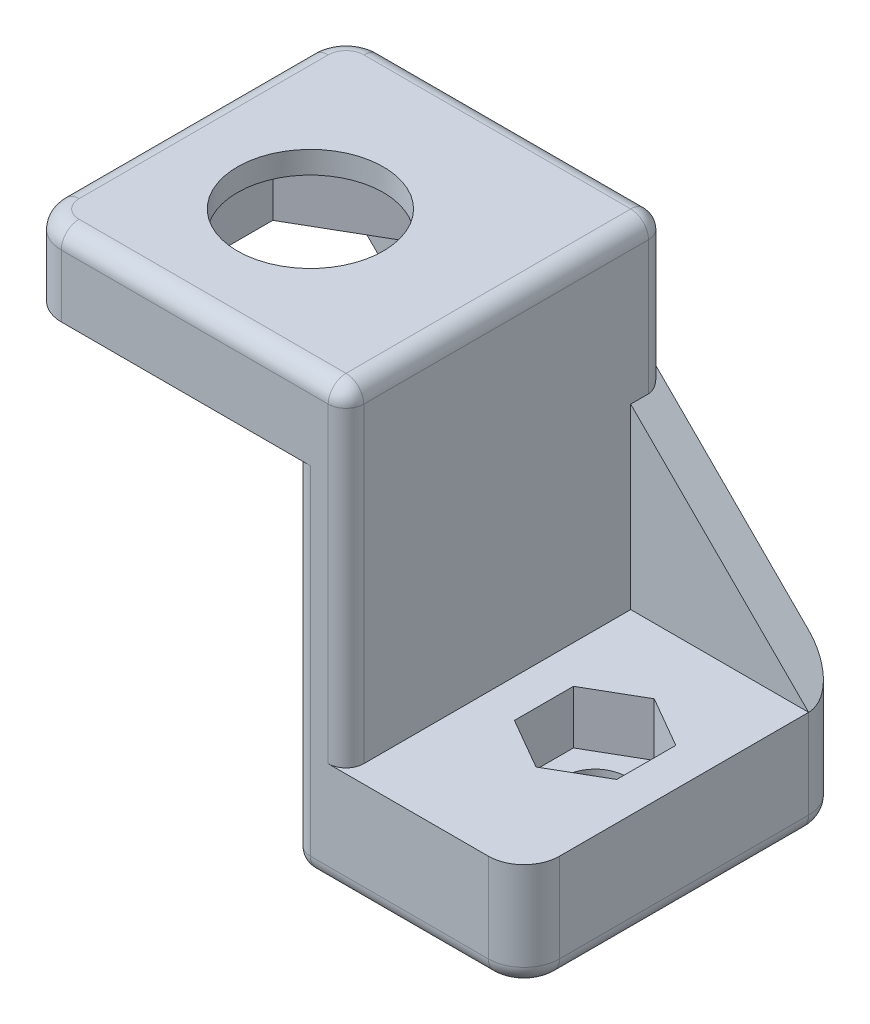
from build123d import *

# Parameters (mm, degrees)
BOSS_EXTRUDE1_DEPTH = 36
SKETCH3_R           = 3.5
CUT_EXTRUDE1_DEPTH  = 32
SKETCH2_R           = 8.2
CUT_EXTRUDE2_DEPTH  = 32
CUT_EXTRUDE3_DEPTH  = 6
BOSS_EXTRUDE3_DEPTH = 4
CUT_EXTRUDE4_DEPTH  = 6.5
FILLET1_R           = 4
FILLET4_R           = 2


with BuildPart() as part:
    # Sketch1 → Boss-Extrude1 (new body)
    with BuildSketch(Plane.XY):
        Polygon((0, 0), (0, 40), (-30, 40), (-30, 49), (6, 49), (6, 12), (26, 12), (26, 0), align=None)
    extrude(amount=BOSS_EXTRUDE1_DEPTH)

    # Sketch3 → Cut-Extrude1 (cut)
    with BuildSketch(Plane(origin=(0, 12, 0), x_dir=(1, 0, 0), z_dir=(0, 1, 0))):
        with Locations((16, -18)):
            Circle(SKETCH3_R)
    extrude(amount=-CUT_EXTRUDE1_DEPTH, mode=Mode.SUBTRACT)

    # Sketch2 → Cut-Extrude2 (cut)
    with BuildSketch(Plane(origin=(0, 49, 0), x_dir=(1, 0, 0), z_dir=(0, 1, 0))):
        with Locations((-14, -20)):
            Circle(SKETCH2_R)
    extrude(amount=-CUT_EXTRUDE2_DEPTH, mode=Mode.SUBTRACT)

    # Sketch4 → Cut-Extrude3 (cut)
    with BuildSketch(Plane(origin=(0, 12, 0), x_dir=(1, 0, 0), z_dir=(0, 1, 0))):
        Polygon((16, -24.639528096), (21.75, -21.319764048), (21.75, -14.680235952), (16, -11.360471904), (10.25, -14.680235952), (10.25, -21.319764048), align=None)
    extrude(amount=-CUT_EXTRUDE3_DEPTH, mode=Mode.SUBTRACT)

    # Sketch5 → Boss-Extrude3 (add)
    with BuildSketch(Plane(origin=(0, 0, 0), x_dir=(-1, 0, 0), z_dir=(0, 0, -1))):
        Polygon((-26, 12), (-6, 32), (-6, 12), align=None)
        Polygon((0, 10), (0, 40), (30, 40), align=None)
    extrude(amount=-BOSS_EXTRUDE3_DEPTH)

    # Sketch6 → Cut-Extrude4 (cut)
    with BuildSketch(Plane.XZ.offset(-40)):
        Polygon((-14, 8.452994616), (-4, 14.226497308), (-4, 25.773502692), (-14, 31.547005384), (-24, 25.773502692), (-24, 14.226497308), align=None)
    extrude(amount=-CUT_EXTRUDE4_DEPTH, mode=Mode.SUBTRACT)

    # Fillet1
    fillet1_edges = [part.edges().sort_by_distance(p)[0] for p in [
        (26, 6, 36),
        (26, 6, 0),
        (-30, 44.5, 36),
        (-30, 44.5, 0),
    ]]
    fillet(fillet1_edges, radius=FILLET1_R)

    # Fillet4
    fillet4_edges = [part.edges().sort_by_distance(p)[0] for p in [
        (11, 0, 36),
        (24.828427125, 0, 34.828427125),
        (11, 0, 0),
        (24.828427125, 0, 1.171572875),
        (-10, 49, 0),
        (-28.828427125, 49, 1.171572875),
        (-30, 49, 18),
        (-28.828427125, 49, 34.828427125),
        (6, 40.5, 0),
        (0, 20, 36),
        (26, 0, 18),
        (0, 0, 18),
        (-10, 49, 36),
        (6, 30.5, 36),
        (6, 49, 18),
    ]]
    fillet(fillet4_edges, radius=FILLET4_R)


solid = part.part
